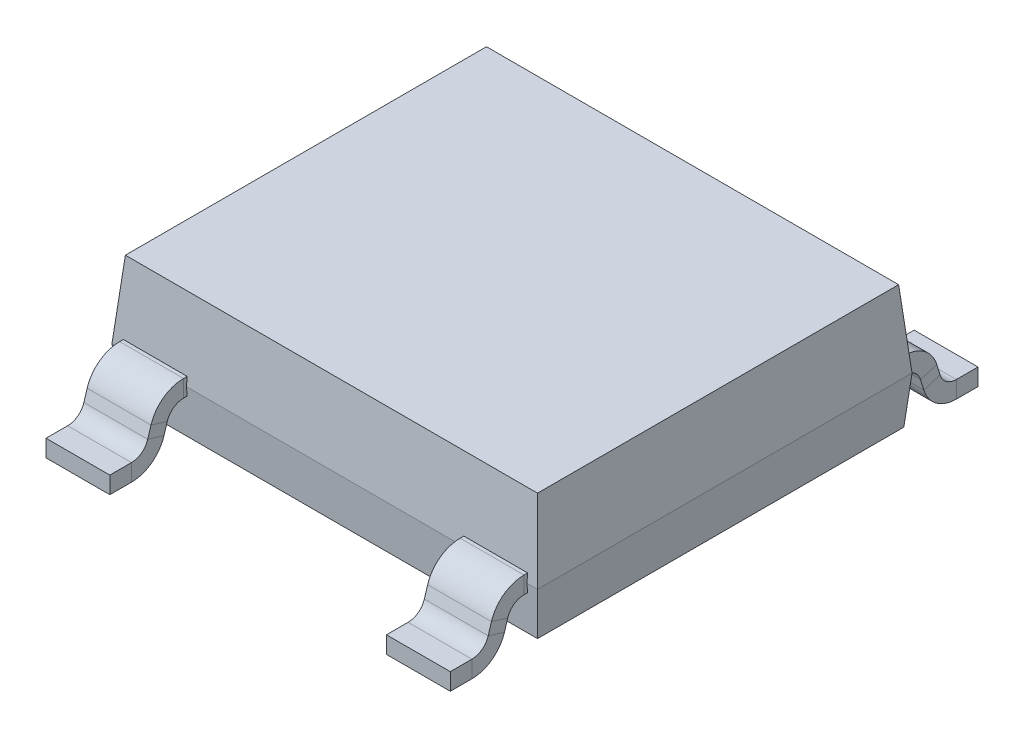
from build123d import *

# Parameters (mm, degrees)
ESQUISSE1_W                    = 5
ESQUISSE1_H                    = 4.4
BOSS_EXTRU_1_DEPTH             = 0.9
BOSS_EXTRU_1_TAPER             = 5
BOSS_EXTRU_1_OTHER_WAY_DEPTH   = 0.55
BOSS_EXTRU_1_OTHER_WAY_TAPER   = 5
T_LE_DE_BASE_PLI_E1_DEPTH      = 0.375
T_LE_DE_BASE_PLI_E1_DEPTH_BACK = 0.375


# Sheet-metal steps are written as plain solids
with BuildPart() as part:
    # Esquisse1 → Boss.-Extru.1 (new body)
    with BuildSketch(Plane(origin=(0, 0, 0), x_dir=(1, 0, 0), z_dir=(0, 1, 0))):
        Rectangle(ESQUISSE1_W, ESQUISSE1_H)
    extrude(amount=BOSS_EXTRU_1_DEPTH, taper=BOSS_EXTRU_1_TAPER)

    # Esquisse1 → Boss.-Extru.1 other way (add)
    with BuildSketch(Plane(origin=(0, 0, 0), x_dir=(1, 0, 0), z_dir=(0, 1, 0))):
        Rectangle(ESQUISSE1_W, ESQUISSE1_H)
    extrude(amount=-BOSS_EXTRU_1_OTHER_WAY_DEPTH, taper=BOSS_EXTRU_1_OTHER_WAY_TAPER)


with BuildPart() as body_2:
    # Esquisse3 → Tôle de base pliée1 (new, two sides: drawn at the far end of the back side and taken through both)
    with BuildSketch(Plane(origin=(2, 0, 0), x_dir=(0, 0, -1), z_dir=(1, 0, 0)).offset(-T_LE_DE_BASE_PLI_E1_DEPTH_BACK)):
        with BuildLine():
            Line((-2.191251134, -0.1), (-2.23385591, -0.1))
            ThreePointArc((-2.23385591, -0.1), (-2.352820468, -0.139228628), (-2.425116861, -0.241525659))
            Line((-2.425116861, -0.241525659), (-2.463462528, -0.366948682))
            ThreePointArc((-2.463462528, -0.366948682), (-2.608055315, -0.571542744), (-2.84598443, -0.65))
            Line((-2.84598443, -0.65), (-3.1, -0.65))
            Line((-3.1, -0.65), (-3.1, -0.45))
            Line((-3.1, -0.45), (-2.84598443, -0.45))
            ThreePointArc((-2.84598443, -0.45), (-2.727019873, -0.410771372), (-2.654723479, -0.308474341))
            Line((-2.654723479, -0.308474341), (-2.616377813, -0.183051318))
            ThreePointArc((-2.616377813, -0.183051318), (-2.471785025, 0.021542744), (-2.23385591, 0.1))
            Line((-2.23385591, 0.1), (-2.191251134, 0.1))
            Line((-2.191251134, 0.1), (-2.191251134, -0.1))
        make_face()
    extrude(amount=T_LE_DE_BASE_PLI_E1_DEPTH + T_LE_DE_BASE_PLI_E1_DEPTH_BACK)


with BuildPart() as body_3:
    # Symétrie1: mirrored copy
    add(body_2.part.mirror(Plane.XY))


with BuildPart() as body_4:
    # Symétrie2: mirrored copy
    add(body_2.part.mirror(Plane(origin=(0, 0, 0), x_dir=(0, 0, 1), z_dir=(1, 0, 0))))


with BuildPart() as body_5:
    # Sym_trie2 2: mirrored copy
    add(body_3.part.mirror(Plane(origin=(0, 0, 0), x_dir=(0, 0, 1), z_dir=(1, 0, 0))))


solid = Compound([part.part, body_2.part, body_3.part, body_4.part, body_5.part])
